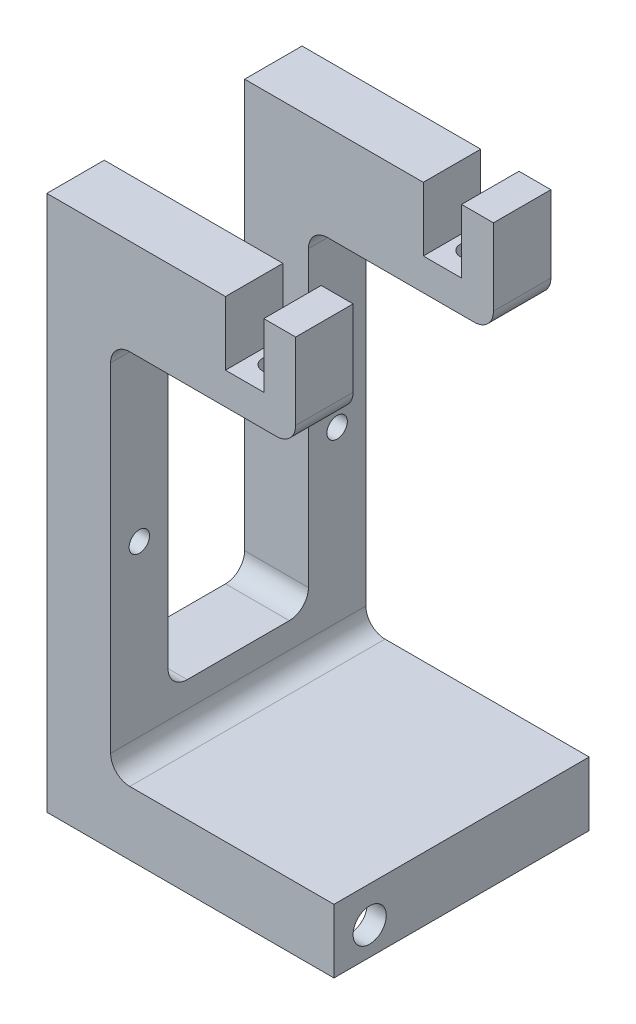
from build123d import *

# Parameters (mm, degrees)
BOSS_EXTRUDE1_DEPTH = 40
SKETCH2_W           = 22
SKETCH2_H           = 67
CUT_EXTRUDE1_DEPTH  = 104.348923555
CUT_EXTRUDE2_REACH  = 97.399
SKETCH4_R           = 1.7
SKETCH7_R           = 2.6
CUT_EXTRUDE3_DEPTH  = 10
FILLET1_R           = 3
FILLET2_R           = 3
SKETCH8_W           = 39
SKETCH8_H           = 34
CUT_EXTRUDE4_DEPTH  = 7
CUT_EXTRUDE5_REACH  = 101.403
SKETCH9_R           = 1.6


with BuildPart() as part:
    # Sketch1 → Boss-Extrude1 (new body)
    with BuildSketch(Plane.XY):
        Polygon((10, 10), (45, 10), (45, 0), (0, 0), (0, 84), (28, 84), (28, 74), (34, 74), (34, 84), (39, 84), (39, 69), (10, 69), align=None)
    extrude(amount=BOSS_EXTRUDE1_DEPTH)

    # Sketch2 → Cut-Extrude1 (cut, through all)
    with BuildSketch(Plane.ZY):
        with Locations((20, 50.5)):
            Rectangle(SKETCH2_W, SKETCH2_H)
    extrude(amount=-CUT_EXTRUDE1_DEPTH, mode=Mode.SUBTRACT)

    # Sketch4 → Cut-Extrude2 (cut, up to next)
    with BuildSketch(Plane(origin=(0, 74, 0), x_dir=(1, 0, 0), z_dir=(0, 1, 0)), mode=Mode.PRIVATE) as cut_extrude2_sk1:
        with Locations((31, -35.5)):
            Circle(SKETCH4_R)
    cut_extrude2_tool1 = extrude(cut_extrude2_sk1.sketch, amount=-CUT_EXTRUDE2_REACH, mode=Mode.PRIVATE) & part.part
    # Sketch4 → Cut-Extrude2 (cut, up to next)
    with BuildSketch(Plane(origin=(0, 74, 0), x_dir=(1, 0, 0), z_dir=(0, 1, 0)), mode=Mode.PRIVATE) as cut_extrude2_sk2:
        with Locations((31, -4.5)):
            Circle(SKETCH4_R)
    cut_extrude2_tool2 = extrude(cut_extrude2_sk2.sketch, amount=-CUT_EXTRUDE2_REACH, mode=Mode.PRIVATE) & part.part
    add(cut_extrude2_tool1.solids().sort_by_distance((31, 74, 35.5))[0], mode=Mode.SUBTRACT)
    add(cut_extrude2_tool2.solids().sort_by_distance((31, 74, 4.5))[0], mode=Mode.SUBTRACT)

    # Sketch7 → Cut-Extrude3 (cut)
    with BuildSketch(Plane(origin=(45, 0, 0), x_dir=(0, 0, -1), z_dir=(1, 0, 0))):
        with Locations((-34.4, 4.4)):
            Circle(SKETCH7_R)
    extrude(amount=-CUT_EXTRUDE3_DEPTH, mode=Mode.SUBTRACT)

    # Fillet1
    fillet1_edges = [part.edges().sort_by_distance(p)[0] for p in [
        (10, 10, 20),
        (5, 17, 31),
        (5, 17, 9),
    ]]
    fillet(fillet1_edges, radius=FILLET1_R)

    # Fillet2
    fillet2_edges = [part.edges().sort_by_distance(p)[0] for p in [
        (39, 69, 4.5),
        (39, 69, 35.5),
        (10, 69, 35.5),
        (10, 69, 4.5),
    ]]
    fillet(fillet2_edges, radius=FILLET2_R)

    # Sketch8 → Cut-Extrude4 (cut)
    with BuildSketch(Plane.XZ):
        with Locations((22.5, 20)):
            Rectangle(SKETCH8_W, SKETCH8_H)
    extrude(amount=-CUT_EXTRUDE4_DEPTH, mode=Mode.SUBTRACT)

    # Sketch9 → Cut-Extrude5 (cut, up to next)
    with BuildSketch(Plane(origin=(10, 0, 0), x_dir=(0, 0, -1), z_dir=(1, 0, 0)), mode=Mode.PRIVATE) as cut_extrude5_sk1:
        with Locations((-4.5, 39.5)):
            Circle(SKETCH9_R)
    cut_extrude5_tool1 = extrude(cut_extrude5_sk1.sketch, amount=-CUT_EXTRUDE5_REACH, mode=Mode.PRIVATE) & part.part
    # Sketch9 → Cut-Extrude5 (cut, up to next)
    with BuildSketch(Plane(origin=(10, 0, 0), x_dir=(0, 0, -1), z_dir=(1, 0, 0)), mode=Mode.PRIVATE) as cut_extrude5_sk2:
        with Locations((-35.5, 39.5)):
            Circle(SKETCH9_R)
    cut_extrude5_tool2 = extrude(cut_extrude5_sk2.sketch, amount=-CUT_EXTRUDE5_REACH, mode=Mode.PRIVATE) & part.part
    add(cut_extrude5_tool1.solids().sort_by_distance((10, 39.5, 4.5))[0], mode=Mode.SUBTRACT)
    add(cut_extrude5_tool2.solids().sort_by_distance((10, 39.5, 35.5))[0], mode=Mode.SUBTRACT)


solid = part.part
